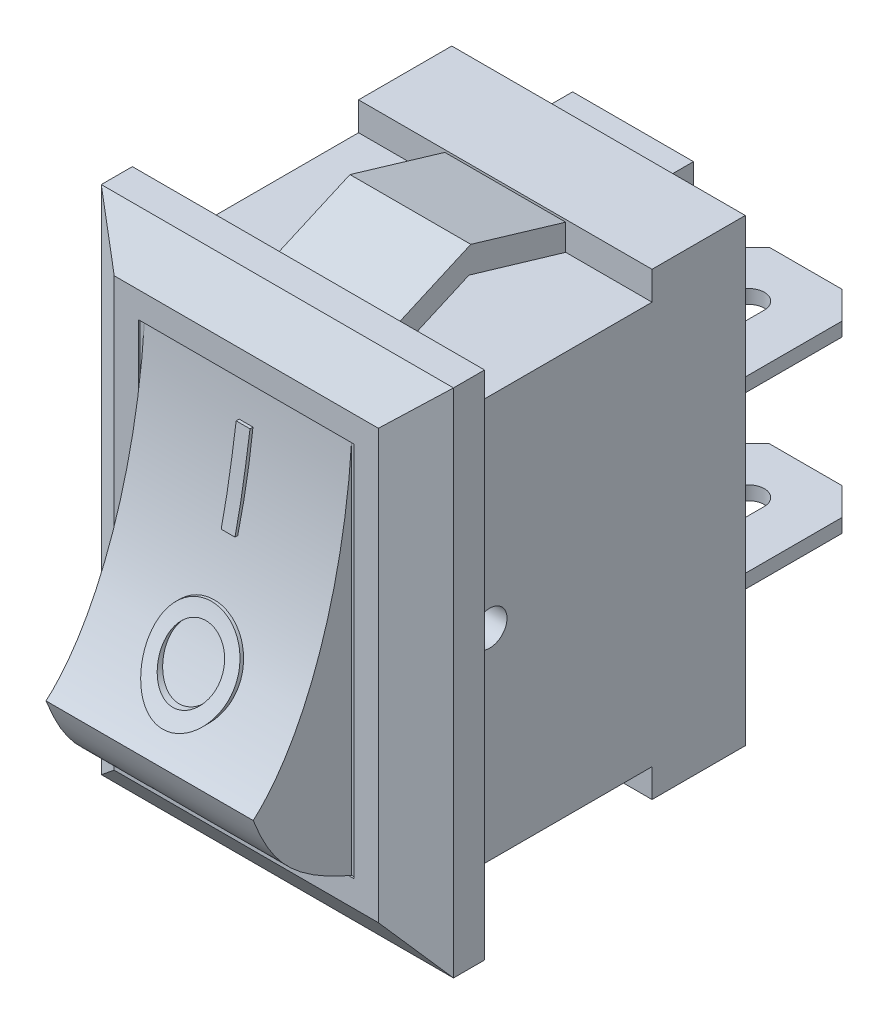
from build123d import *

# Parameters (mm, degrees)
SKETCH1_W                = 10.2
SKETCH1_H                = 14.8
BOSS_EXTRUDE1_DEPTH      = 1.8
SKETCH2_W                = 6.25
SKETCH2_H                = 10.9
CUT_EXTRUDE1_DEPTH       = 0.05
CUT_EXTRUDE2_DEPTH       = 10.165696918
CUT_EXTRUDE3_DEPTH       = 10.165696918
BOSS_EXTRUDE2_DEPTH      = 4.25
BOSS_EXTRUDE2_DEPTH_BACK = 4.25
SKETCH7_W                = 3.5
SKETCH7_H                = 2.65
BOSS_EXTRUDE3_DEPTH      = 1
SKETCH8_W                = 6.7
SKETCH8_H                = 2.65
BOSS_EXTRUDE4_DEPTH      = 0.2
BOSS_EXTRUDE5_DEPTH      = 5
BOSS_EXTRUDE5_DEPTH_BACK = 1.5
SKETCH12_W               = 3.7
SKETCH12_H               = 0.4
CHAMFER1_SIZE            = 0.8
CUT_EXTRUDE4_DEPTH       = 18.062532051
BOSS_EXTRUDE6_DEPTH      = 1.75
SKETCH15_R               = 0.5
CUT_EXTRUDE5_DEPTH       = 1
BOSS_EXTRUDE7_DEPTH      = 3
BOSS_EXTRUDE7_DEPTH_BACK = 3
SKETCH17_R               = 1.25
SKETCH17_R_2             = 0.85
SKETCH17_W               = 0.4
SKETCH17_H               = 2.5
BOSS_EXTRUDE10_DEPTH     = 3
CUT_EXTRUDE6_DEPTH       = 19.103314614


with BuildPart() as part:
    # Sketch1 → Boss-Extrude1 (new body)
    with BuildSketch(Plane.XY):
        Rectangle(SKETCH1_W, SKETCH1_H)
    extrude(amount=BOSS_EXTRUDE1_DEPTH)

    # Sketch2 → Cut-Extrude1 (cut)
    with BuildSketch(Plane.XY.offset(1.8)):
        Rectangle(SKETCH2_W, SKETCH2_H)
    extrude(amount=-CUT_EXTRUDE1_DEPTH, mode=Mode.SUBTRACT)

    # Sketch4 → Cut-Extrude2 (cut, symmetric)
    with BuildSketch(Plane(origin=(0, 0, 0), x_dir=(0, 0, -1), z_dir=(1, 0, 0))):
        Polygon((-1.8, 6.2), (-0.9, 7.4), (-1.8, 7.4), align=None)
    cut_extrude2 = extrude(amount=CUT_EXTRUDE2_DEPTH, both=True, mode=Mode.SUBTRACT)

    # Mirror1: Cut-Extrude2 across plane
    add(cut_extrude2.mirror(Plane.ZX), mode=Mode.SUBTRACT)

    # Sketch5 → Cut-Extrude3 (cut, symmetric)
    with BuildSketch(Plane(origin=(0, 0, 0), x_dir=(1, 0, 0), z_dir=(0, 1, 0))):
        Polygon((-5.1, -1.8), (-3.825, -1.8), (-5.1, -0.9), align=None)
    cut_extrude3 = extrude(amount=CUT_EXTRUDE3_DEPTH, both=True, mode=Mode.SUBTRACT)

    # Mirror2: Cut-Extrude3 across plane
    add(cut_extrude3.mirror(Plane(origin=(0, 0, 0), x_dir=(0, 0, 1), z_dir=(1, 0, 0))), mode=Mode.SUBTRACT)

    # Sketch6 → Boss-Extrude2 (add, two sides: drawn at the far end of the back side and taken through both)
    with BuildSketch(Plane(origin=(0, 0, 0), x_dir=(0, 0, -1), z_dir=(1, 0, 0)).offset(-BOSS_EXTRUDE2_DEPTH_BACK)):
        Polygon((0, 5.825), (5.7, 5.825), (5.7, 6.65), (8.4, 6.65), (8.4, -6.65), (5.7, -6.65), (5.7, -5.825), (0, -5.825), align=None)
    extrude(amount=BOSS_EXTRUDE2_DEPTH + BOSS_EXTRUDE2_DEPTH_BACK)

    # Sketch7 → Boss-Extrude3 (add)
    with BuildSketch(Plane(origin=(0, 0, -8.4), x_dir=(-1, 0, 0), z_dir=(0, 0, -1))):
        with Locations((0, 4.925)):
            Rectangle(SKETCH7_W, SKETCH7_H)
        Rectangle(SKETCH7_W, SKETCH7_H)
        with Locations((0, -4.925)):
            Rectangle(SKETCH7_W, SKETCH7_H)
    extrude(amount=BOSS_EXTRUDE3_DEPTH)

    # Sketch8 → Boss-Extrude4 (add)
    with BuildSketch(Plane(origin=(0, 0, -8.4), x_dir=(-1, 0, 0), z_dir=(0, 0, -1))):
        with Locations((0, 4.925)):
            Rectangle(SKETCH8_W, SKETCH8_H)
        Rectangle(SKETCH8_W, SKETCH8_H)
        with Locations((0, -4.925)):
            Rectangle(SKETCH8_W, SKETCH8_H)
    extrude(amount=BOSS_EXTRUDE4_DEPTH)

    # Sketch12 → Boss-Extrude5 (add, two sides: drawn at the far end of the back side and taken through both)
    with BuildSketch(Plane(origin=(0, 0, -9.4), x_dir=(-1, 0, 0), z_dir=(0, 0, -1)).offset(-BOSS_EXTRUDE5_DEPTH_BACK)):
        Rectangle(SKETCH12_W, SKETCH12_H)
        with Locations((0, -4.925)):
            Rectangle(SKETCH12_W, SKETCH12_H)
    extrude(amount=BOSS_EXTRUDE5_DEPTH + BOSS_EXTRUDE5_DEPTH_BACK)

    # Chamfer1
    chamfer1_edges = [part.edges().sort_by_distance(p)[0] for p in [
        (-1.85, -4.925, -8.6),
        (-1.85, 0, -8.6),
        (1.85, -4.925, -8.6),
        (1.85, 0, -8.6),
        (1.85, -4.925, -14.4),
        (-1.85, -4.925, -14.4),
        (-1.85, 0, -14.4),
        (1.85, 0, -14.4),
    ]]
    chamfer(chamfer1_edges, length=CHAMFER1_SIZE)

    # Sketch13 → Cut-Extrude4 (cut, through all)
    with BuildSketch(Plane(origin=(0, 0.2, 0), x_dir=(1, 0, 0), z_dir=(0, 1, 0))):
        with BuildLine():
            Line((0.45, 12.75), (0.45, 11.55))
            ThreePointArc((0.45, 11.55), (0, 11.1), (-0.45, 11.55))
            Line((-0.45, 11.55), (-0.45, 12.75))
            ThreePointArc((-0.45, 12.75), (0, 13.2), (0.45, 12.75))
        make_face()
    extrude(amount=-CUT_EXTRUDE4_DEPTH, mode=Mode.SUBTRACT)

    # Sketch14 → Boss-Extrude6 (add, symmetric)
    with BuildSketch(Plane(origin=(0, 0, 0), x_dir=(0, 0, -1), z_dir=(1, 0, 0))):
        Polygon((5.7, 6.581901118), (2.951211879, 7.4), (0, 6.096596717), (0, 5.825), (1.022149578, 5.825), (2.89851051, 6.65369516), (5.7, 5.825), align=None)
    boss_extrude6 = extrude(amount=BOSS_EXTRUDE6_DEPTH, both=True)

    # Mirror3: Boss-Extrude6 across plane
    add(boss_extrude6.mirror(Plane.ZX))

    # Sketch15 → Cut-Extrude5 (cut)
    with BuildSketch(Plane(origin=(4.25, 0, 0), x_dir=(0, 0, -1), z_dir=(1, 0, 0))):
        with Locations((1, 0)):
            Circle(SKETCH15_R)
    cut_extrude5 = extrude(amount=-CUT_EXTRUDE5_DEPTH, mode=Mode.SUBTRACT)

    # Mirror4: Cut-Extrude5 across plane
    add(cut_extrude5.mirror(Plane(origin=(0, 0, 0), x_dir=(0, 0, 1), z_dir=(1, 0, 0))), mode=Mode.SUBTRACT)

    # Sketch16 → Boss-Extrude7 (add, two sides: drawn at the far end of the back side and taken through both)
    with BuildSketch(Plane(origin=(0, 0, 0), x_dir=(0, 0, -1), z_dir=(1, 0, 0)).offset(-BOSS_EXTRUDE7_DEPTH_BACK)):
        with BuildLine():
            Line((-1.75, 5.45), (-1.75, -5.45))
            add(Edge.make_bspline(
                [(-1.75, -5.45), (-3.529930344, -4.698713531), (-4.113957414, -3.89718415), (-4.6, -2.65)],
                knots=[0, 0, 0, 0, 1, 1, 1, 1], degree=3))
            add(Edge.make_bspline(
                [(-4.6, -2.65), (-3.045765396, -1.290380774), (-1.96741903, 1.96934222), (-1.75, 5.45)],
                knots=[0, 0, 0, 0, 1, 1, 1, 1], degree=3))
        make_face()
    extrude(amount=BOSS_EXTRUDE7_DEPTH + BOSS_EXTRUDE7_DEPTH_BACK)

    # Sketch17 → Boss-Extrude10 (add)
    # profile 1 of 2: a face of its own
    with BuildSketch(Plane.XY.offset(1.81)):
        with Locations((0, -0.8)):
            Circle(SKETCH17_R)
        with Locations((0, -0.8)):
            Circle(SKETCH17_R_2, mode=Mode.SUBTRACT)
    # profile 2 of 2: a face of its own
    with BuildSketch(Plane.XY.offset(1.81)):
        with Locations((0.029387381, 3.2)):
            Rectangle(SKETCH17_W, SKETCH17_H)
    extrude(amount=BOSS_EXTRUDE10_DEPTH)

    # Sketch18 → Cut-Extrude6 (cut, through all)
    with BuildSketch(Plane(origin=(3, 0, 0), x_dir=(0, 0, -1), z_dir=(1, 0, 0))):
        with BuildLine():
            Line((-1.9, 4.608608478), (-5.877914131, 4.608608478))
            Line((-5.877914131, 4.608608478), (-5.877914131, -2.397848694))
            Line((-5.877914131, -2.397848694), (-4.5, -2.397848694))
            add(Edge.make_bspline(
                [(-1.9, 4.608608478), (-2.290337518, 1.868608993), (-2.609137058, -0.12015973), (-4.5, -2.397848694)],
                knots=[0, 0, 0, 0, 1, 1, 1, 1], degree=3))
        make_face()
    extrude(amount=-CUT_EXTRUDE6_DEPTH, mode=Mode.SUBTRACT)


solid = part.part
